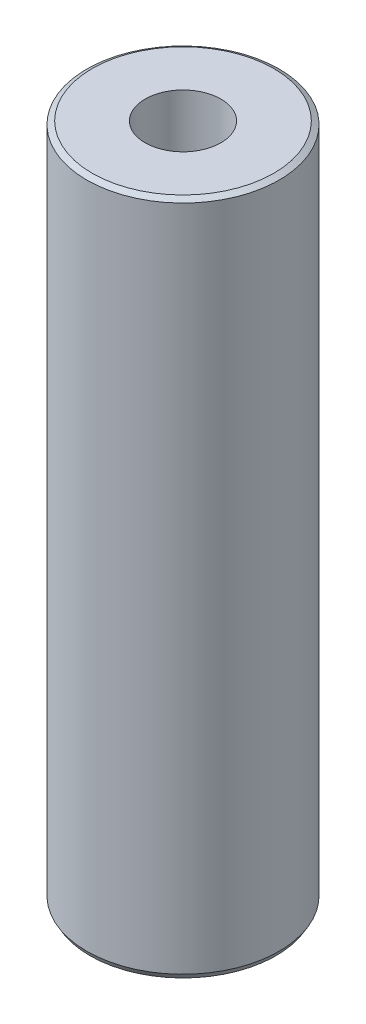
from build123d import *
from OCP.BRepFilletAPI import BRepFilletAPI_MakeChamfer

# Parameters (mm, degrees)
SKETCH1_R           = 37.5
BOSS_EXTRUDE1_DEPTH = 263.669780207
SKETCH2_R           = 14.780743644
CUT_EXTRUDE1_DEPTH  = 269.950279781
CHAMFER1_SIZE       = 1.224541606
CHAMFER1_SIZE2      = 2.120968278


with BuildPart() as part:
    # Sketch1 → Boss-Extrude1 (new body)
    with BuildSketch(Plane(origin=(0, 0, 0), x_dir=(1, 0, 0), z_dir=(0, 1, 0))):
        Circle(SKETCH1_R)
    extrude(amount=BOSS_EXTRUDE1_DEPTH)

    # Sketch2 → Cut-Extrude1 (cut, through all)
    with BuildSketch(Plane(origin=(0, 0, 0), x_dir=(1, 0, 0), z_dir=(0, 1, 0))):
        Circle(SKETCH2_R)
    extrude(amount=CUT_EXTRUDE1_DEPTH, mode=Mode.SUBTRACT)

    # Chamfer1: one chamfer whose edges measure the first distance from different faces: ONE call of the kernel's chamfer builder (chamfer() names one face for all edges)
    chamfer1_edges_1 = [part.edges().sort_by_distance(p)[0] for p in [
        (-37.5, 263.669780207, 0),
    ]]
    chamfer1_side_1 = [part.faces().sort_by_distance(p)[0] for p in [
        (-37.5, 131.834890103, 0),
    ]]
    chamfer1_edges_2 = [part.edges().sort_by_distance(p)[0] for p in [
        (-37.5, 0, 0),
    ]]
    chamfer1_side_2 = [part.faces().sort_by_distance(p)[0] for p in [
        (-36.439339828, 0, 0),
    ]]
    chamfer1 = BRepFilletAPI_MakeChamfer(part.part.solid().wrapped)
    for e in chamfer1_edges_1:
        chamfer1.Add(CHAMFER1_SIZE, CHAMFER1_SIZE2, e.wrapped, chamfer1_side_1[0].wrapped)  # the first distance lies on this face
    for e in chamfer1_edges_2:
        chamfer1.Add(CHAMFER1_SIZE, CHAMFER1_SIZE2, e.wrapped, chamfer1_side_2[0].wrapped)  # the first distance lies on this face
    add(Compound.cast(chamfer1.Shape()), mode=Mode.REPLACE)


solid = part.part
